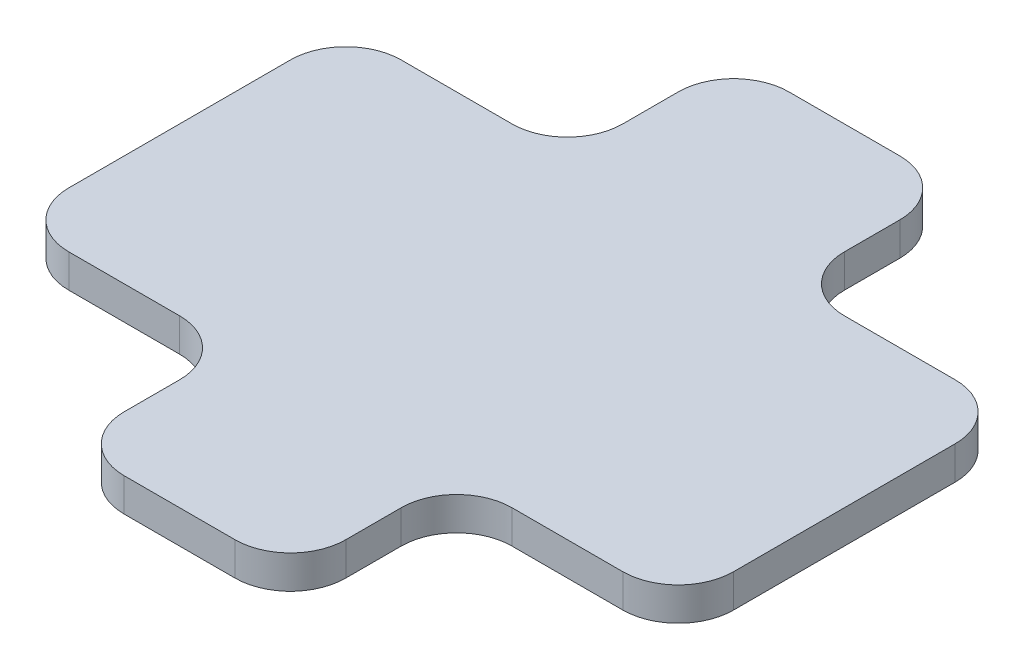
from build123d import *

# Parameters (mm, degrees)
EXTRUDE_1_DEPTH = 3
FILLET_1_R      = 5


with BuildPart() as part:
    # 草图1 → 凸台-拉伸1 (new body)
    with BuildSketch(Plane(origin=(0, 0, 0), x_dir=(1, 0, 0), z_dir=(0, 1, 0))):
        Polygon((10, 15), (30, 15), (30, -15), (10, -15), (10, -30), (-10, -30), (-10, -15), (-30, -15), (-30, 15), (-10, 15), (-10, 30), (10, 30), align=None)
    extrude(amount=EXTRUDE_1_DEPTH)

    # 圆角1
    fillet_1_edges = [part.edges().sort_by_distance(p)[0] for p in [
        (-30, 1.5, 15),
        (-10, 1.5, 15),
        (-10, 1.5, 30),
        (10, 1.5, 30),
        (10, 1.5, 15),
        (30, 1.5, 15),
        (30, 1.5, -15),
        (-30, 1.5, -15),
        (-10, 1.5, -15),
        (10, 1.5, -15),
        (10, 1.5, -30),
        (-10, 1.5, -30),
    ]]
    fillet(fillet_1_edges, radius=FILLET_1_R)


solid = part.part
